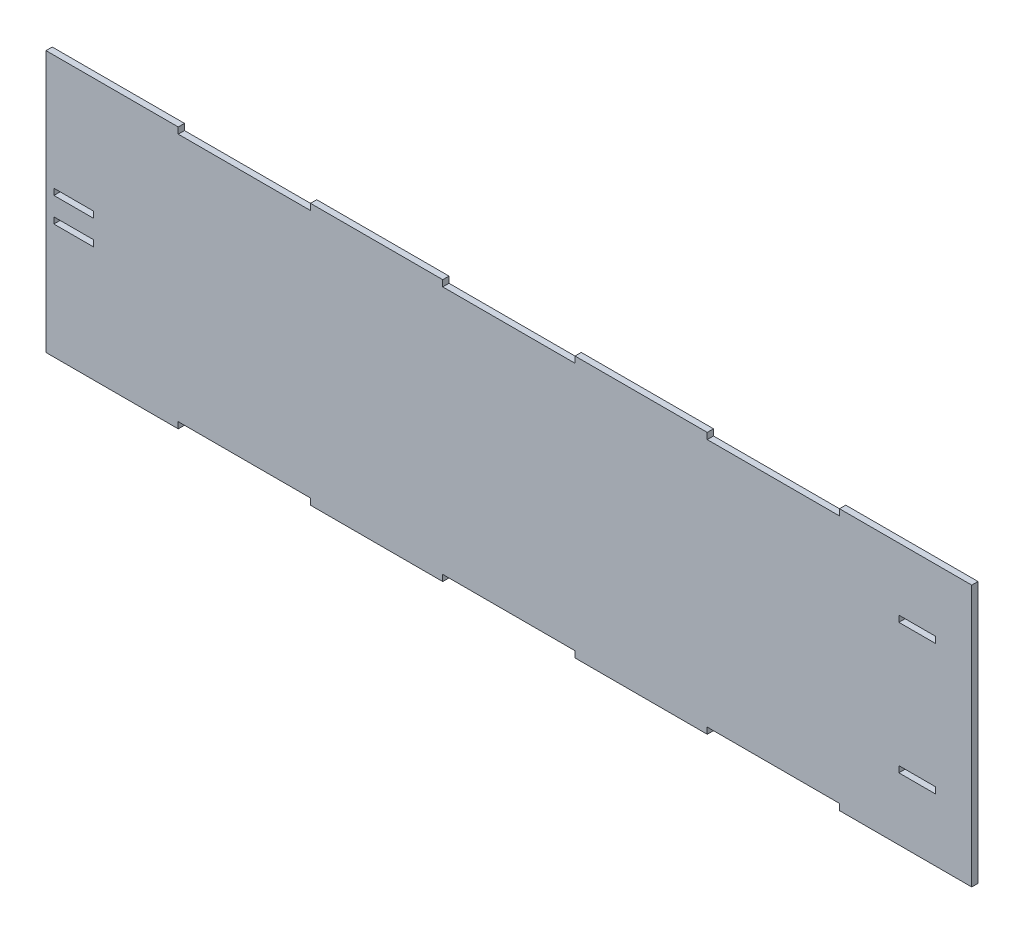
from build123d import *

# Parameters (mm, degrees)
SKETCH1_W           = 20
SKETCH1_H           = 3.175
SKETCH1_W_2         = 18.5
BOSS_EXTRUDE1_DEPTH = 3.175


with BuildPart() as part:
    # Sketch1 → Boss-Extrude1 (new body)
    with BuildSketch(Plane.XY):
        Polygon((0, 132.75), (67.142857143, 132.75), (67.142857143, 129.575), (134.285714286, 129.575), (134.285714286, 132.75), (201.428571429, 132.75), (201.428571429, 129.575), (268.571428571, 129.575), (268.571428571, 132.75), (335.714285714, 132.75), (335.714285714, 129.575), (402.857142857, 129.575), (402.857142857, 132.75), (470, 132.75), (470, 0), (402.857142857, 0), (402.857142857, 3.175), (335.714285714, 3.175), (335.714285714, 0), (268.571428571, 0), (268.571428571, 3.175), (201.428571429, 3.175), (201.428571429, 0), (134.285714286, 0), (134.285714286, 3.175), (67.142857143, 3.175), (67.142857143, 0), (0, 0), align=None)
        with Locations((14, 60.0875)):
            Rectangle(SKETCH1_W, SKETCH1_H, mode=Mode.SUBTRACT)
        with Locations((14, 72.6625)):
            Rectangle(SKETCH1_W, SKETCH1_H, mode=Mode.SUBTRACT)
        with Locations((442.25, 33.2875)):
            Rectangle(SKETCH1_W_2, SKETCH1_H, mode=Mode.SUBTRACT)
        with Locations((442.25, 99.4625)):
            Rectangle(SKETCH1_W_2, SKETCH1_H, mode=Mode.SUBTRACT)
    extrude(amount=BOSS_EXTRUDE1_DEPTH)


solid = part.part
